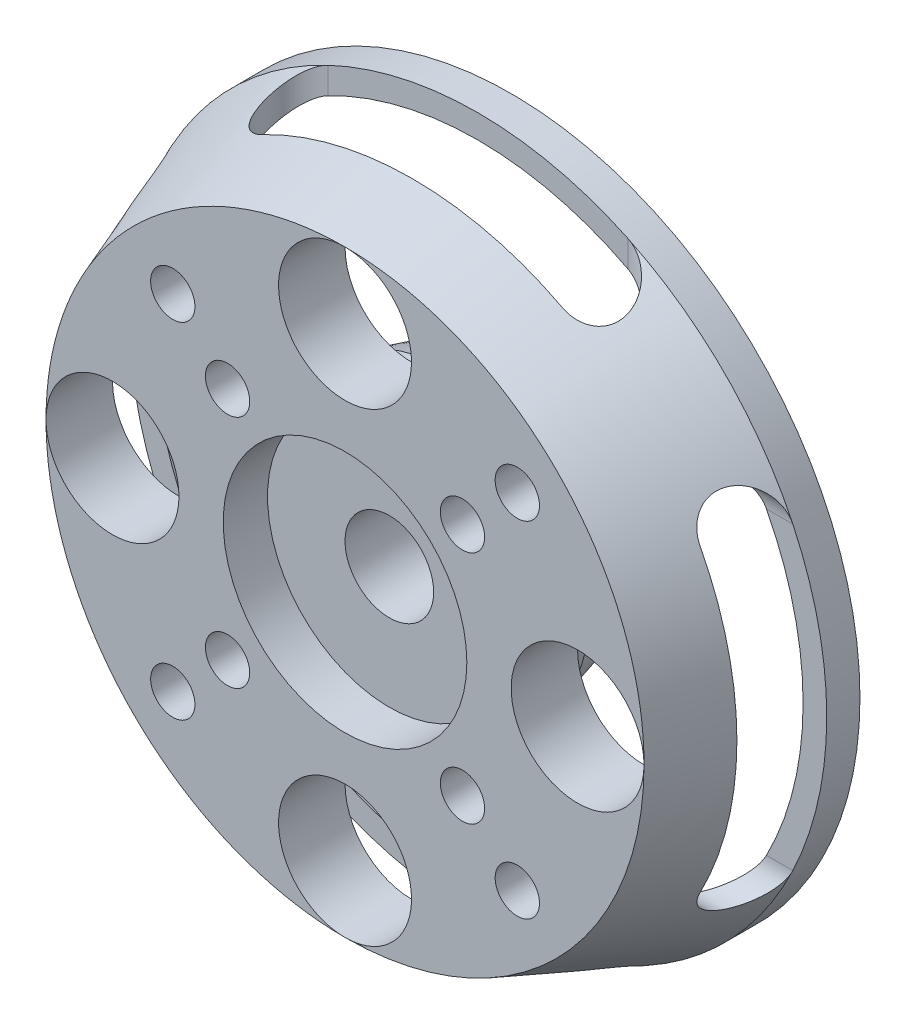
from build123d import *

# Parameters (mm, degrees)
CUT_EXTRUDE1_DEPTH = 10
CIRPATTERN1_COUNT  = 4
SKETCH3_R          = 6
SKETCH3_R_2        = 2
CUT_EXTRUDE2_DEPTH = 48.005318848


with BuildPart() as part:
    # Sketch1 → Revolve1 (revolve)
    with BuildSketch(Plane(origin=(0, 0, 0), x_dir=(1, 0, 0), z_dir=(0, 1, 0))):
        Polygon((29.5, 15), (29.5, 12.362669164), (27.113999064, 6), (13, 6), (13, 9), (11.392304845, 15), (4, 15), (4, 4), (11, 4), (11, 0), (27, 0), (31.5, 12), (31.5, 15), align=None)
    revolve(axis=Axis((0, 0, 76.888888889), (0, 0, -1)))

    # Sketch2 → Cut-Extrude1 (cut)
    with BuildSketch(Plane.ZY.offset(31.5)):
        with BuildLine():
            Line((-12, -13.55), (-12, 13.55))
            ThreePointArc((-12, 13.55), (-9.05, 16.5), (-6.1, 13.55))
            Line((-6.1, 13.55), (-6.1, -13.55))
            ThreePointArc((-6.1, -13.55), (-9.05, -16.5), (-12, -13.55))
        make_face()
    cut_extrude1 = extrude(amount=-CUT_EXTRUDE1_DEPTH, mode=Mode.SUBTRACT)

    # CirPattern1: Cut-Extrude1 ×4 about axis
    cirpattern1_axis = Axis((0, 0, -15.75), (0, 0, 1))
    for i in range(1, CIRPATTERN1_COUNT):
        add(cut_extrude1.rotate(cirpattern1_axis, i * 360 / CIRPATTERN1_COUNT), mode=Mode.SUBTRACT)

    # Sketch3 → Cut-Extrude2 (cut, through all)
    with BuildSketch(Plane.XY):
        with Locations((-21, 0)):
            Circle(SKETCH3_R)
        with Locations((0, 21)):
            Circle(SKETCH3_R)
        with Locations((21, 0)):
            Circle(SKETCH3_R)
        with Locations((0, -21)):
            Circle(SKETCH3_R)
        with Locations((-15.556349186, 15.556349186)):
            Circle(SKETCH3_R_2)
        with Locations((-10.606601718, 10.606601718)):
            Circle(SKETCH3_R_2)
        with Locations((10.606601718, 10.606601718)):
            Circle(SKETCH3_R_2)
        with Locations((15.556349186, 15.556349186)):
            Circle(SKETCH3_R_2)
        with Locations((10.606601718, -10.606601718)):
            Circle(SKETCH3_R_2)
        with Locations((15.556349186, -15.556349186)):
            Circle(SKETCH3_R_2)
        with Locations((-10.606601718, -10.606601718)):
            Circle(SKETCH3_R_2)
        with Locations((-15.556349186, -15.556349186)):
            Circle(SKETCH3_R_2)
    extrude(amount=-CUT_EXTRUDE2_DEPTH, mode=Mode.SUBTRACT)


solid = part.part
